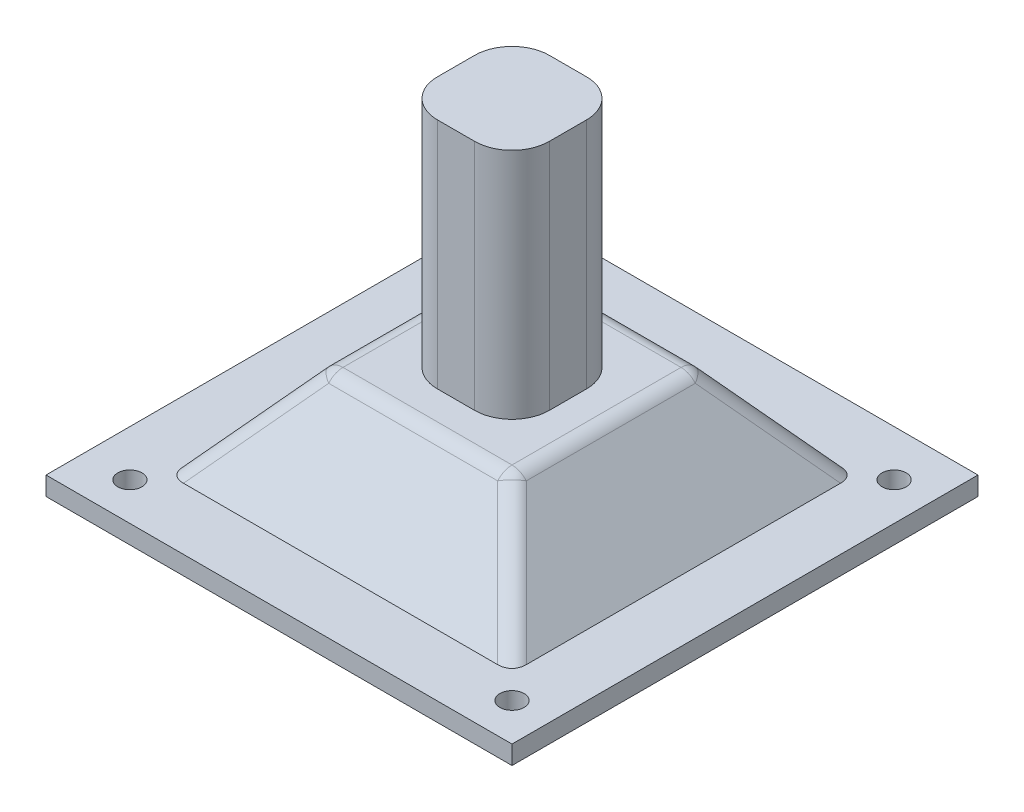
from build123d import *

# Parameters (mm, degrees)
SKETCH1_W            = 15.24
SKETCH1_H            = 15.24
BOSS_EXTRUDE1_DEPTH  = 31.75
FILLET1_R            = 5.08
SKETCH2_W            = 25.4
SKETCH2_H            = 25.4
BOSS_EXTRUDE3_DEPTH  = 12.7
BOSS_EXTRUDE3_DRAFT  = -40
SKETCH5_W            = 41.633130632
SKETCH5_H            = 41.633130632
CUT_EXTRUDE1_DEPTH   = 10.16
CUT_EXTRUDE1_DRAFT   = -40
FILLET2_R            = 2.54
SKETCH6_W            = 63.5
SKETCH6_H            = 63.5
BOSS_EXTRUDE4_DEPTH  = 2.54
SKETCH7_R            = 1.651
CUT_EXTRUDE2_DEPTH   = 64.181702256
LPATTERN1_COUNT      = 2
LPATTERN1_PITCH      = 52.07
LPATTERN1_COUNT_DIR2 = 2
LPATTERN1_PITCH_DIR2 = 52.07


with BuildPart() as part:
    # Sketch1 → Boss-Extrude1 (new body)
    with BuildSketch(Plane(origin=(0, 0, 0), x_dir=(1, 0, 0), z_dir=(0, 1, 0))):
        Rectangle(SKETCH1_W, SKETCH1_H)
    extrude(amount=BOSS_EXTRUDE1_DEPTH)

    # Fillet1
    fillet1_edges = [part.edges().sort_by_distance(p)[0] for p in [
        (-7.62, 15.875, 7.62),
        (7.62, 15.875, 7.62),
        (7.62, 15.875, -7.62),
        (-7.62, 15.875, -7.62),
    ]]
    fillet(fillet1_edges, radius=FILLET1_R)


with BuildPart() as boss_extrude3_tool:
    # Sketch2 → Boss-Extrude3 (with draft: the straight prism first)
    with BuildSketch(Plane.XZ):
        Rectangle(SKETCH2_W, SKETCH2_H)
    extrude(amount=BOSS_EXTRUDE3_DEPTH)
    # Boss-Extrude3: the draft: its side faces are tilted about the plane it starts from
    boss_extrude3_sides = [boss_extrude3_tool.faces().sort_by_distance(p)[0] for p in [
        (12.7, -6.35, 0),
        (0, -6.35, 12.7),
        (-12.7, -6.35, 0),
        (0, -6.35, -12.7),
    ]]
    draft(boss_extrude3_sides, Plane.XZ, BOSS_EXTRUDE3_DRAFT)


with BuildPart() as part_1:
    add(part.part)

    # Boss-Extrude3: add boss_extrude3_tool
    add(boss_extrude3_tool.part)


with BuildPart() as cut_extrude1_tool:
    # Sketch5 → Cut-Extrude1 (with draft: the straight prism first)
    with BuildSketch(Plane.XZ.offset(12.7)):
        Rectangle(SKETCH5_W, SKETCH5_H)
    extrude(amount=-CUT_EXTRUDE1_DEPTH)
    # Cut-Extrude1: the draft: its side faces are tilted about the plane it starts from
    cut_extrude1_sides = [cut_extrude1_tool.faces().sort_by_distance(p)[0] for p in [
        (-20.816565316, -7.62, 0),
        (0, -7.62, -20.816565316),
        (20.816565316, -7.62, 0),
        (0, -7.62, 20.816565316),
    ]]
    draft(cut_extrude1_sides, Plane.XZ.offset(12.7), CUT_EXTRUDE1_DRAFT)


with BuildPart() as part_2:
    add(part_1.part)

    # Cut-Extrude1: cut by cut_extrude1_tool
    add(cut_extrude1_tool.part, mode=Mode.SUBTRACT)

    # Fillet2
    fillet2_edges = [part_2.edges().sort_by_distance(p)[0] for p in [
        (-12.7, 0, 0),
        (0, 0, -12.7),
        (12.7, 0, 0),
        (0, 0, 12.7),
        (-18.028282658, -6.35, -18.028282658),
        (18.028282658, -6.35, -18.028282658),
        (18.028282658, -6.35, 18.028282658),
        (-18.028282658, -6.35, 18.028282658),
    ]]
    fillet(fillet2_edges, radius=FILLET2_R)

    # Sketch6 → Boss-Extrude4 (add)
    with BuildSketch(Plane.XZ.offset(12.7)):
        Rectangle(SKETCH6_W, SKETCH6_H)
    extrude(amount=BOSS_EXTRUDE4_DEPTH)

    # Sketch7 → Cut-Extrude2 (cut, through all)
    with BuildSketch(Plane(origin=(0, -12.7, 0), x_dir=(1, 0, 0), z_dir=(0, 1, 0))):
        with Locations((-25.463820715, 25.463820715)):
            Circle(SKETCH7_R)
    cut_extrude2 = extrude(amount=-CUT_EXTRUDE2_DEPTH, mode=Mode.SUBTRACT)

    # LPattern1: Cut-Extrude2 2 × 2
    with Locations(*[(i * LPATTERN1_PITCH, 0, j * LPATTERN1_PITCH_DIR2) for i in range(LPATTERN1_COUNT) for j in range(LPATTERN1_COUNT_DIR2) if (i, j) != (0, 0)]):
        add(cut_extrude2, mode=Mode.SUBTRACT)


solid = part_2.part
